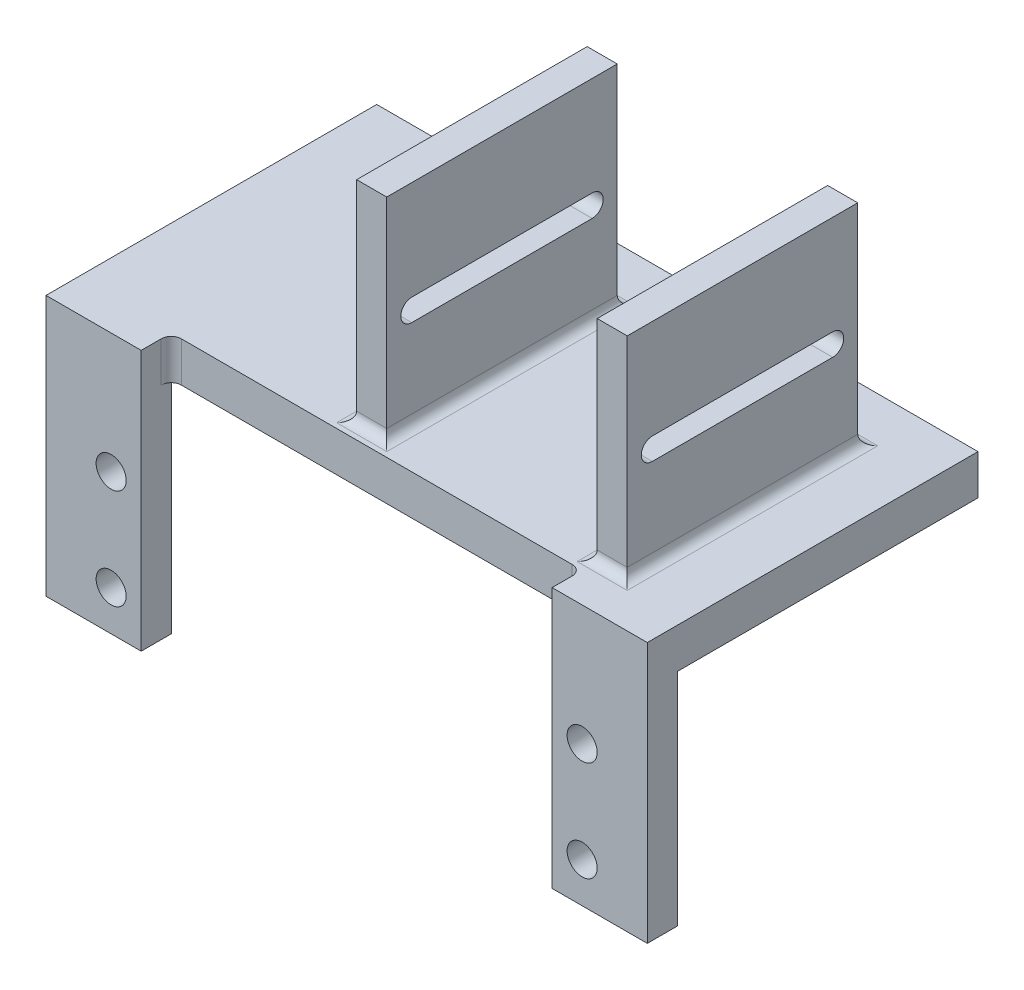
from build123d import *

# Parameters (mm, degrees)
SKETCH1_W           = 60
SKETCH1_H           = 30
BOSS_EXTRUDE1_DEPTH = 4
SKETCH2_W           = 9.5
SKETCH2_H           = 3
BOSS_EXTRUDE2_DEPTH = 26
SKETCH3_R           = 1.5
CUT_EXTRUDE1_DEPTH  = 4
SKETCH4_W           = 3
SKETCH4_H           = 23
BOSS_EXTRUDE4_DEPTH = 21
CUT_EXTRUDE2_DEPTH  = 27
FILLET1_R           = 1


with BuildPart() as part:
    # Sketch1 → Boss-Extrude1 (new body)
    with BuildSketch(Plane(origin=(0, 0, 0), x_dir=(1, 0, 0), z_dir=(0, 1, 0))):
        Rectangle(SKETCH1_W, SKETCH1_H)
    extrude(amount=BOSS_EXTRUDE1_DEPTH)

    # Sketch2 → Boss-Extrude2 (add)
    with BuildSketch(Plane(origin=(0, 4, 0), x_dir=(1, 0, 0), z_dir=(0, 1, 0))):
        with Locations((-25.25, -16.5)):
            Rectangle(SKETCH2_W, SKETCH2_H)
        with Locations((25.25, -16.5)):
            Rectangle(SKETCH2_W, SKETCH2_H)
    extrude(amount=-BOSS_EXTRUDE2_DEPTH)

    # Sketch3 → Cut-Extrude1 (cut)
    with BuildSketch(Plane.XY.offset(18)):
        with Locations((-23.5, -8)):
            Circle(SKETCH3_R)
        with Locations((-23.5, -18)):
            Circle(SKETCH3_R)
        with Locations(Location((23.5, -18, 0), (0, 0, 180))):
            Circle(SKETCH3_R)
        with Locations(Location((23.5, -8, 0), (0, 0, 180))):
            Circle(SKETCH3_R)
    extrude(amount=-CUT_EXTRUDE1_DEPTH, mode=Mode.SUBTRACT)

    # Sketch4 → Boss-Extrude4 (add)
    with BuildSketch(Plane(origin=(0, 4, 0), x_dir=(1, 0, 0), z_dir=(0, 1, 0))):
        with Locations((-2, -2)):
            Rectangle(SKETCH4_W, SKETCH4_H)
        with Locations((22, -2)):
            Rectangle(SKETCH4_W, SKETCH4_H)
    extrude(amount=BOSS_EXTRUDE4_DEPTH)

    # Sketch5 → Cut-Extrude2 (cut)
    with BuildSketch(Plane.ZY.offset(3.5)):
        with BuildLine():
            Line((-7, 15.1), (11, 15.1))
            ThreePointArc((11, 15.1), (12.1, 14), (11, 12.9))
            Line((11, 12.9), (-7, 12.9))
            ThreePointArc((-7, 12.9), (-8.1, 14), (-7, 15.1))
        make_face()
    extrude(amount=-CUT_EXTRUDE2_DEPTH, mode=Mode.SUBTRACT)

    # Fillet1
    # the kernel refuses this fillet: 1 mm, written as the material it adds along each edge
    with BuildSketch(Plane(origin=(-20.5, 4, 15), x_dir=(1, 0, 0), z_dir=(0, -1, 0))) as fillet1_piece_1_section:
        with BuildLine():
            CenterArc((FILLET1_R, FILLET1_R), FILLET1_R, 180, 90)
            Line((0, FILLET1_R), (-FILLET1_R * 0.02, FILLET1_R))
            Line((-FILLET1_R * 0.02, FILLET1_R), (-FILLET1_R * 0.02, -FILLET1_R * 0.02))
            Line((-FILLET1_R * 0.02, -FILLET1_R * 0.02), (FILLET1_R, -FILLET1_R * 0.02))
            Line((FILLET1_R, -FILLET1_R * 0.02), (FILLET1_R, 0))
        make_face()
    fillet1_piece_1 = extrude(amount=4, mode=Mode.PRIVATE)
    fillet1_piece_1 = split(fillet1_piece_1, bisect_by=Plane(origin=(-20.29652687, 2, 15), z_dir=(0, 0, 1)), keep=Keep.TOP, mode=Mode.PRIVATE)
    add(fillet1_piece_1)
    with BuildSketch(Plane(origin=(20.5, 4, 15), x_dir=(-1, 0, 0), z_dir=(0, -1, 0))) as fillet1_piece_2_section:
        with BuildLine():
            CenterArc((FILLET1_R, -FILLET1_R), FILLET1_R, 90, 90)
            Line((0, -FILLET1_R), (-FILLET1_R * 0.02, -FILLET1_R))
            Line((-FILLET1_R * 0.02, -FILLET1_R), (-FILLET1_R * 0.02, FILLET1_R * 0.02))
            Line((-FILLET1_R * 0.02, FILLET1_R * 0.02), (FILLET1_R, FILLET1_R * 0.02))
            Line((FILLET1_R, FILLET1_R * 0.02), (FILLET1_R, 0))
        make_face()
    fillet1_piece_2 = extrude(amount=4, mode=Mode.PRIVATE)
    fillet1_piece_2 = split(fillet1_piece_2, bisect_by=Plane(origin=(20.29652687, 2, 15), z_dir=(0, 0, 1)), keep=Keep.TOP, mode=Mode.PRIVATE)
    add(fillet1_piece_2)
    with BuildSketch(Plane(origin=(-0.5, 4, 13.5), x_dir=(1, 0, 0), z_dir=(0, 0, -1)), Plane(origin=(-3.5, 4, -9.5), x_dir=(-1, 0, 0), z_dir=(0, 0, 1)), Plane(origin=(23.5, 4, 13.5), x_dir=(1, 0, 0), z_dir=(0, 0, -1)), Plane(origin=(20.5, 4, -9.5), x_dir=(-1, 0, 0), z_dir=(0, 0, 1))) as fillet1_piece_3:
        with BuildLine():
            CenterArc((FILLET1_R, -FILLET1_R), FILLET1_R, 90, 90)
            Line((0, -FILLET1_R), (-FILLET1_R * 0.02, -FILLET1_R))
            Line((-FILLET1_R * 0.02, -FILLET1_R), (-FILLET1_R * 0.02, FILLET1_R * 0.02))
            Line((-FILLET1_R * 0.02, FILLET1_R * 0.02), (FILLET1_R, FILLET1_R * 0.02))
            Line((FILLET1_R, FILLET1_R * 0.02), (FILLET1_R, 0))
        make_face()
    extrude(amount=23)
    with BuildSketch(Plane(origin=(-0.5, 4, -9.5), x_dir=(0, 0, -1), z_dir=(-1, 0, 0)), Plane(origin=(-3.5, 4, 13.5), x_dir=(0, 0, 1), z_dir=(1, 0, 0)), Plane(origin=(23.5, 4, -9.5), x_dir=(0, 0, -1), z_dir=(-1, 0, 0)), Plane(origin=(20.5, 4, 13.5), x_dir=(0, 0, 1), z_dir=(1, 0, 0))) as fillet1_piece_4:
        with BuildLine():
            CenterArc((FILLET1_R, -FILLET1_R), FILLET1_R, 90, 90)
            Line((0, -FILLET1_R), (-FILLET1_R * 0.02, -FILLET1_R))
            Line((-FILLET1_R * 0.02, -FILLET1_R), (-FILLET1_R * 0.02, FILLET1_R * 0.02))
            Line((-FILLET1_R * 0.02, FILLET1_R * 0.02), (FILLET1_R, FILLET1_R * 0.02))
            Line((FILLET1_R, FILLET1_R * 0.02), (FILLET1_R, 0))
        make_face()
    extrude(amount=3)
    with BuildSketch(Plane(origin=(-3.5, 4, 13.5), x_dir=(0, 0, 1), z_dir=(1, 0, 0))) as fillet1_piece_5a_section:
        with BuildLine():
            CenterArc((FILLET1_R, -FILLET1_R), FILLET1_R, 90, 90)
            Line((0, -FILLET1_R), (-FILLET1_R * 0.02, -FILLET1_R))
            Line((-FILLET1_R * 0.02, -FILLET1_R), (-FILLET1_R * 0.02, FILLET1_R * 0.02))
            Line((-FILLET1_R * 0.02, FILLET1_R * 0.02), (FILLET1_R, FILLET1_R * 0.02))
            Line((FILLET1_R, FILLET1_R * 0.02), (FILLET1_R, 0))
        make_face()
    fillet1_piece_5a = extrude(amount=5.5, mode=Mode.PRIVATE)
    fillet1_piece_5a = split(fillet1_piece_5a, bisect_by=Plane(origin=(-0.5, 4.226395114, 13.726395114), z_dir=(1, 0, 0)), keep=Keep.TOP, mode=Mode.PRIVATE)
    with BuildSketch(Plane(origin=(-0.5, 4, 16), x_dir=(1, 0, 0), z_dir=(0, 0, -1))) as fillet1_piece_5b_section:
        with BuildLine():
            CenterArc((FILLET1_R, -FILLET1_R), FILLET1_R, 90, 90)
            Line((0, -FILLET1_R), (-FILLET1_R * 0.02, -FILLET1_R))
            Line((-FILLET1_R * 0.02, -FILLET1_R), (-FILLET1_R * 0.02, FILLET1_R * 0.02))
            Line((-FILLET1_R * 0.02, FILLET1_R * 0.02), (FILLET1_R, FILLET1_R * 0.02))
            Line((FILLET1_R, FILLET1_R * 0.02), (FILLET1_R, 0))
        make_face()
    fillet1_piece_5b = extrude(amount=25.5, mode=Mode.PRIVATE)
    fillet1_piece_5b = split(fillet1_piece_5b, bisect_by=Plane(origin=(-0.273604886, 4.226395114, 13.5), z_dir=(0, 0, 1)), keep=Keep.TOP, mode=Mode.PRIVATE)
    fillet1_piece_5 = fillet1_piece_5a & fillet1_piece_5b
    add(fillet1_piece_5)
    with BuildSketch(Plane(origin=(-0.5, 4, 13.5), x_dir=(1, 0, 0), z_dir=(0, 0, -1))) as fillet1_piece_6a_section:
        with BuildLine():
            CenterArc((FILLET1_R, -FILLET1_R), FILLET1_R, 90, 90)
            Line((0, -FILLET1_R), (-FILLET1_R * 0.02, -FILLET1_R))
            Line((-FILLET1_R * 0.02, -FILLET1_R), (-FILLET1_R * 0.02, FILLET1_R * 0.02))
            Line((-FILLET1_R * 0.02, FILLET1_R * 0.02), (FILLET1_R, FILLET1_R * 0.02))
            Line((FILLET1_R, FILLET1_R * 0.02), (FILLET1_R, 0))
        make_face()
    fillet1_piece_6a = extrude(amount=25.5, mode=Mode.PRIVATE)
    fillet1_piece_6a = split(fillet1_piece_6a, bisect_by=Plane(origin=(-0.273604886, 4.226395114, -9.5), z_dir=(0, 0, -1)), keep=Keep.TOP, mode=Mode.PRIVATE)
    with BuildSketch(Plane(origin=(2, 4, -9.5), x_dir=(0, 0, -1), z_dir=(-1, 0, 0))) as fillet1_piece_6b_section:
        with BuildLine():
            CenterArc((FILLET1_R, -FILLET1_R), FILLET1_R, 90, 90)
            Line((0, -FILLET1_R), (-FILLET1_R * 0.02, -FILLET1_R))
            Line((-FILLET1_R * 0.02, -FILLET1_R), (-FILLET1_R * 0.02, FILLET1_R * 0.02))
            Line((-FILLET1_R * 0.02, FILLET1_R * 0.02), (FILLET1_R, FILLET1_R * 0.02))
            Line((FILLET1_R, FILLET1_R * 0.02), (FILLET1_R, 0))
        make_face()
    fillet1_piece_6b = extrude(amount=5.5, mode=Mode.PRIVATE)
    fillet1_piece_6b = split(fillet1_piece_6b, bisect_by=Plane(origin=(-0.5, 4.226395114, -9.726395114), z_dir=(1, 0, 0)), keep=Keep.TOP, mode=Mode.PRIVATE)
    fillet1_piece_6 = fillet1_piece_6a & fillet1_piece_6b
    add(fillet1_piece_6)
    with BuildSketch(Plane(origin=(-0.5, 4, -9.5), x_dir=(0, 0, -1), z_dir=(-1, 0, 0))) as fillet1_piece_7a_section:
        with BuildLine():
            CenterArc((FILLET1_R, -FILLET1_R), FILLET1_R, 90, 90)
            Line((0, -FILLET1_R), (-FILLET1_R * 0.02, -FILLET1_R))
            Line((-FILLET1_R * 0.02, -FILLET1_R), (-FILLET1_R * 0.02, FILLET1_R * 0.02))
            Line((-FILLET1_R * 0.02, FILLET1_R * 0.02), (FILLET1_R, FILLET1_R * 0.02))
            Line((FILLET1_R, FILLET1_R * 0.02), (FILLET1_R, 0))
        make_face()
    fillet1_piece_7a = extrude(amount=5.5, mode=Mode.PRIVATE)
    fillet1_piece_7a = split(fillet1_piece_7a, bisect_by=Plane(origin=(-3.5, 4.226395114, -9.726395114), z_dir=(-1, 0, 0)), keep=Keep.TOP, mode=Mode.PRIVATE)
    with BuildSketch(Plane(origin=(-3.5, 4, -12), x_dir=(-1, 0, 0), z_dir=(0, 0, 1))) as fillet1_piece_7b_section:
        with BuildLine():
            CenterArc((FILLET1_R, -FILLET1_R), FILLET1_R, 90, 90)
            Line((0, -FILLET1_R), (-FILLET1_R * 0.02, -FILLET1_R))
            Line((-FILLET1_R * 0.02, -FILLET1_R), (-FILLET1_R * 0.02, FILLET1_R * 0.02))
            Line((-FILLET1_R * 0.02, FILLET1_R * 0.02), (FILLET1_R, FILLET1_R * 0.02))
            Line((FILLET1_R, FILLET1_R * 0.02), (FILLET1_R, 0))
        make_face()
    fillet1_piece_7b = extrude(amount=25.5, mode=Mode.PRIVATE)
    fillet1_piece_7b = split(fillet1_piece_7b, bisect_by=Plane(origin=(-3.726395114, 4.226395114, -9.5), z_dir=(0, 0, -1)), keep=Keep.TOP, mode=Mode.PRIVATE)
    fillet1_piece_7 = fillet1_piece_7a & fillet1_piece_7b
    add(fillet1_piece_7)
    with BuildSketch(Plane(origin=(-6, 4, 13.5), x_dir=(0, 0, 1), z_dir=(1, 0, 0))) as fillet1_piece_8a_section:
        with BuildLine():
            CenterArc((FILLET1_R, -FILLET1_R), FILLET1_R, 90, 90)
            Line((0, -FILLET1_R), (-FILLET1_R * 0.02, -FILLET1_R))
            Line((-FILLET1_R * 0.02, -FILLET1_R), (-FILLET1_R * 0.02, FILLET1_R * 0.02))
            Line((-FILLET1_R * 0.02, FILLET1_R * 0.02), (FILLET1_R, FILLET1_R * 0.02))
            Line((FILLET1_R, FILLET1_R * 0.02), (FILLET1_R, 0))
        make_face()
    fillet1_piece_8a = extrude(amount=5.5, mode=Mode.PRIVATE)
    fillet1_piece_8a = split(fillet1_piece_8a, bisect_by=Plane(origin=(-3.5, 4.226395114, 13.726395114), z_dir=(-1, 0, 0)), keep=Keep.TOP, mode=Mode.PRIVATE)
    with BuildSketch(Plane(origin=(-3.5, 4, -9.5), x_dir=(-1, 0, 0), z_dir=(0, 0, 1))) as fillet1_piece_8b_section:
        with BuildLine():
            CenterArc((FILLET1_R, -FILLET1_R), FILLET1_R, 90, 90)
            Line((0, -FILLET1_R), (-FILLET1_R * 0.02, -FILLET1_R))
            Line((-FILLET1_R * 0.02, -FILLET1_R), (-FILLET1_R * 0.02, FILLET1_R * 0.02))
            Line((-FILLET1_R * 0.02, FILLET1_R * 0.02), (FILLET1_R, FILLET1_R * 0.02))
            Line((FILLET1_R, FILLET1_R * 0.02), (FILLET1_R, 0))
        make_face()
    fillet1_piece_8b = extrude(amount=25.5, mode=Mode.PRIVATE)
    fillet1_piece_8b = split(fillet1_piece_8b, bisect_by=Plane(origin=(-3.726395114, 4.226395114, 13.5), z_dir=(0, 0, 1)), keep=Keep.TOP, mode=Mode.PRIVATE)
    fillet1_piece_8 = fillet1_piece_8a & fillet1_piece_8b
    add(fillet1_piece_8)
    with BuildSketch(Plane(origin=(20.5, 4, 13.5), x_dir=(0, 0, 1), z_dir=(1, 0, 0))) as fillet1_piece_9a_section:
        with BuildLine():
            CenterArc((FILLET1_R, -FILLET1_R), FILLET1_R, 90, 90)
            Line((0, -FILLET1_R), (-FILLET1_R * 0.02, -FILLET1_R))
            Line((-FILLET1_R * 0.02, -FILLET1_R), (-FILLET1_R * 0.02, FILLET1_R * 0.02))
            Line((-FILLET1_R * 0.02, FILLET1_R * 0.02), (FILLET1_R, FILLET1_R * 0.02))
            Line((FILLET1_R, FILLET1_R * 0.02), (FILLET1_R, 0))
        make_face()
    fillet1_piece_9a = extrude(amount=5.5, mode=Mode.PRIVATE)
    fillet1_piece_9a = split(fillet1_piece_9a, bisect_by=Plane(origin=(23.5, 4.226395114, 13.726395114), z_dir=(1, 0, 0)), keep=Keep.TOP, mode=Mode.PRIVATE)
    with BuildSketch(Plane(origin=(23.5, 4, 16), x_dir=(1, 0, 0), z_dir=(0, 0, -1))) as fillet1_piece_9b_section:
        with BuildLine():
            CenterArc((FILLET1_R, -FILLET1_R), FILLET1_R, 90, 90)
            Line((0, -FILLET1_R), (-FILLET1_R * 0.02, -FILLET1_R))
            Line((-FILLET1_R * 0.02, -FILLET1_R), (-FILLET1_R * 0.02, FILLET1_R * 0.02))
            Line((-FILLET1_R * 0.02, FILLET1_R * 0.02), (FILLET1_R, FILLET1_R * 0.02))
            Line((FILLET1_R, FILLET1_R * 0.02), (FILLET1_R, 0))
        make_face()
    fillet1_piece_9b = extrude(amount=25.5, mode=Mode.PRIVATE)
    fillet1_piece_9b = split(fillet1_piece_9b, bisect_by=Plane(origin=(23.726395114, 4.226395114, 13.5), z_dir=(0, 0, 1)), keep=Keep.TOP, mode=Mode.PRIVATE)
    fillet1_piece_9 = fillet1_piece_9a & fillet1_piece_9b
    add(fillet1_piece_9)
    with BuildSketch(Plane(origin=(26, 4, -9.5), x_dir=(0, 0, -1), z_dir=(-1, 0, 0))) as fillet1_piece_10a_section:
        with BuildLine():
            CenterArc((FILLET1_R, -FILLET1_R), FILLET1_R, 90, 90)
            Line((0, -FILLET1_R), (-FILLET1_R * 0.02, -FILLET1_R))
            Line((-FILLET1_R * 0.02, -FILLET1_R), (-FILLET1_R * 0.02, FILLET1_R * 0.02))
            Line((-FILLET1_R * 0.02, FILLET1_R * 0.02), (FILLET1_R, FILLET1_R * 0.02))
            Line((FILLET1_R, FILLET1_R * 0.02), (FILLET1_R, 0))
        make_face()
    fillet1_piece_10a = extrude(amount=5.5, mode=Mode.PRIVATE)
    fillet1_piece_10a = split(fillet1_piece_10a, bisect_by=Plane(origin=(23.5, 4.226395114, -9.726395114), z_dir=(1, 0, 0)), keep=Keep.TOP, mode=Mode.PRIVATE)
    with BuildSketch(Plane(origin=(23.5, 4, 13.5), x_dir=(1, 0, 0), z_dir=(0, 0, -1))) as fillet1_piece_10b_section:
        with BuildLine():
            CenterArc((FILLET1_R, -FILLET1_R), FILLET1_R, 90, 90)
            Line((0, -FILLET1_R), (-FILLET1_R * 0.02, -FILLET1_R))
            Line((-FILLET1_R * 0.02, -FILLET1_R), (-FILLET1_R * 0.02, FILLET1_R * 0.02))
            Line((-FILLET1_R * 0.02, FILLET1_R * 0.02), (FILLET1_R, FILLET1_R * 0.02))
            Line((FILLET1_R, FILLET1_R * 0.02), (FILLET1_R, 0))
        make_face()
    fillet1_piece_10b = extrude(amount=25.5, mode=Mode.PRIVATE)
    fillet1_piece_10b = split(fillet1_piece_10b, bisect_by=Plane(origin=(23.726395114, 4.226395114, -9.5), z_dir=(0, 0, -1)), keep=Keep.TOP, mode=Mode.PRIVATE)
    fillet1_piece_10 = fillet1_piece_10a & fillet1_piece_10b
    add(fillet1_piece_10)
    with BuildSketch(Plane(origin=(23.5, 4, -9.5), x_dir=(0, 0, -1), z_dir=(-1, 0, 0))) as fillet1_piece_11a_section:
        with BuildLine():
            CenterArc((FILLET1_R, -FILLET1_R), FILLET1_R, 90, 90)
            Line((0, -FILLET1_R), (-FILLET1_R * 0.02, -FILLET1_R))
            Line((-FILLET1_R * 0.02, -FILLET1_R), (-FILLET1_R * 0.02, FILLET1_R * 0.02))
            Line((-FILLET1_R * 0.02, FILLET1_R * 0.02), (FILLET1_R, FILLET1_R * 0.02))
            Line((FILLET1_R, FILLET1_R * 0.02), (FILLET1_R, 0))
        make_face()
    fillet1_piece_11a = extrude(amount=5.5, mode=Mode.PRIVATE)
    fillet1_piece_11a = split(fillet1_piece_11a, bisect_by=Plane(origin=(20.5, 4.226395114, -9.726395114), z_dir=(-1, 0, 0)), keep=Keep.TOP, mode=Mode.PRIVATE)
    with BuildSketch(Plane(origin=(20.5, 4, -12), x_dir=(-1, 0, 0), z_dir=(0, 0, 1))) as fillet1_piece_11b_section:
        with BuildLine():
            CenterArc((FILLET1_R, -FILLET1_R), FILLET1_R, 90, 90)
            Line((0, -FILLET1_R), (-FILLET1_R * 0.02, -FILLET1_R))
            Line((-FILLET1_R * 0.02, -FILLET1_R), (-FILLET1_R * 0.02, FILLET1_R * 0.02))
            Line((-FILLET1_R * 0.02, FILLET1_R * 0.02), (FILLET1_R, FILLET1_R * 0.02))
            Line((FILLET1_R, FILLET1_R * 0.02), (FILLET1_R, 0))
        make_face()
    fillet1_piece_11b = extrude(amount=25.5, mode=Mode.PRIVATE)
    fillet1_piece_11b = split(fillet1_piece_11b, bisect_by=Plane(origin=(20.273604886, 4.226395114, -9.5), z_dir=(0, 0, -1)), keep=Keep.TOP, mode=Mode.PRIVATE)
    fillet1_piece_11 = fillet1_piece_11a & fillet1_piece_11b
    add(fillet1_piece_11)
    with BuildSketch(Plane(origin=(20.5, 4, -9.5), x_dir=(-1, 0, 0), z_dir=(0, 0, 1))) as fillet1_piece_12a_section:
        with BuildLine():
            CenterArc((FILLET1_R, -FILLET1_R), FILLET1_R, 90, 90)
            Line((0, -FILLET1_R), (-FILLET1_R * 0.02, -FILLET1_R))
            Line((-FILLET1_R * 0.02, -FILLET1_R), (-FILLET1_R * 0.02, FILLET1_R * 0.02))
            Line((-FILLET1_R * 0.02, FILLET1_R * 0.02), (FILLET1_R, FILLET1_R * 0.02))
            Line((FILLET1_R, FILLET1_R * 0.02), (FILLET1_R, 0))
        make_face()
    fillet1_piece_12a = extrude(amount=25.5, mode=Mode.PRIVATE)
    fillet1_piece_12a = split(fillet1_piece_12a, bisect_by=Plane(origin=(20.273604886, 4.226395114, 13.5), z_dir=(0, 0, 1)), keep=Keep.TOP, mode=Mode.PRIVATE)
    with BuildSketch(Plane(origin=(18, 4, 13.5), x_dir=(0, 0, 1), z_dir=(1, 0, 0))) as fillet1_piece_12b_section:
        with BuildLine():
            CenterArc((FILLET1_R, -FILLET1_R), FILLET1_R, 90, 90)
            Line((0, -FILLET1_R), (-FILLET1_R * 0.02, -FILLET1_R))
            Line((-FILLET1_R * 0.02, -FILLET1_R), (-FILLET1_R * 0.02, FILLET1_R * 0.02))
            Line((-FILLET1_R * 0.02, FILLET1_R * 0.02), (FILLET1_R, FILLET1_R * 0.02))
            Line((FILLET1_R, FILLET1_R * 0.02), (FILLET1_R, 0))
        make_face()
    fillet1_piece_12b = extrude(amount=5.5, mode=Mode.PRIVATE)
    fillet1_piece_12b = split(fillet1_piece_12b, bisect_by=Plane(origin=(20.5, 4.226395114, 13.726395114), z_dir=(-1, 0, 0)), keep=Keep.TOP, mode=Mode.PRIVATE)
    fillet1_piece_12 = fillet1_piece_12a & fillet1_piece_12b
    add(fillet1_piece_12)


solid = part.part
